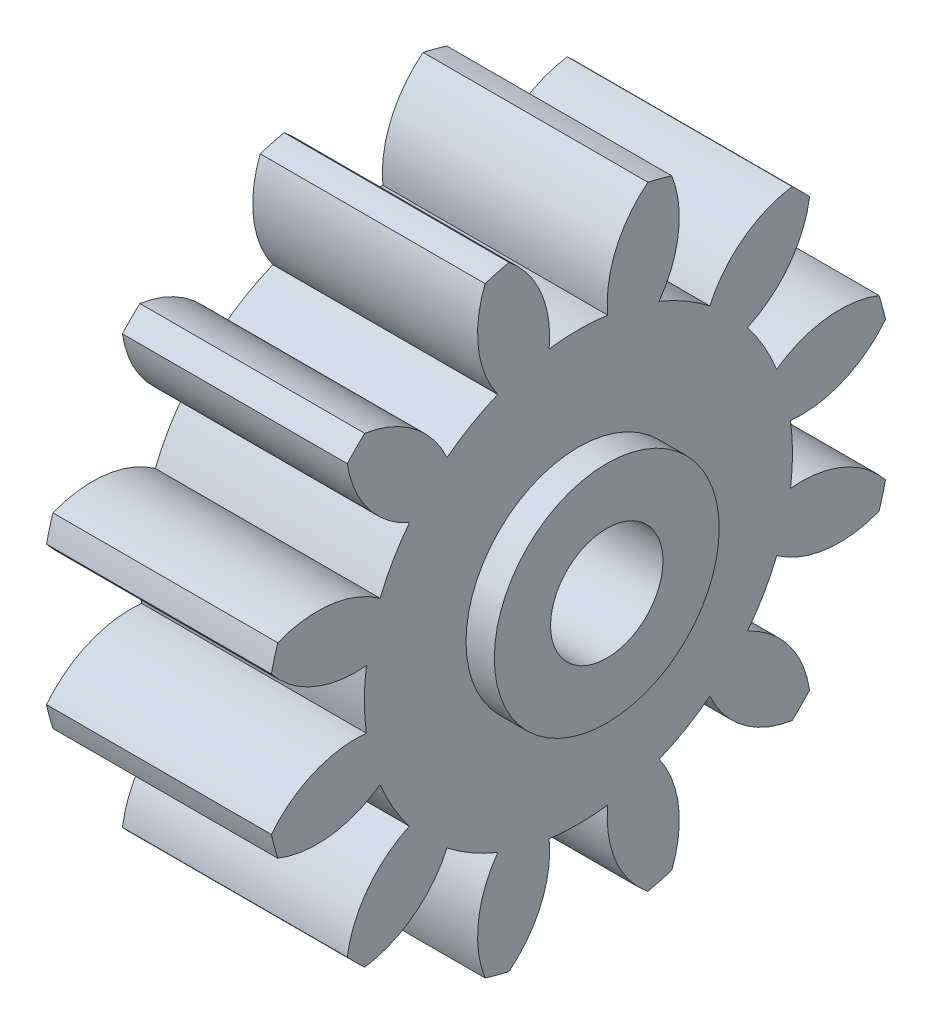
from build123d import *

# Parameters (mm, degrees)
SPUR_START             = -44.990479754
SPUR_GEAR_AI_OUTLINE_R = 1.5875
SPUR_GEAR_AI_DEPTH     = 6.35
SKETCH1_R              = 3.175
SKETCH1_R_2            = 1.5875
BOSS_EXTRUDE1_DEPTH    = 0.8001
BOSS_EXTRUDE2_START    = 0.8001
SKETCH2_R              = 3.175
SKETCH2_R_2            = 1.5875
BOSS_EXTRUDE2_DEPTH    = 0.8001


# Read off the part's stored shape, not the designer's step: spur gear_ai
with BuildPart() as part:
    # spur gear_ai outline → spur gear_ai (new body)
    with BuildSketch(Plane.YZ.offset(SPUR_START)):
        with BuildLine():
            ThreePointArc((12.717986851, 12.671800633), (12.969814044, 12.913920885), (13.211934296, 13.165748078))
            ThreePointArc((13.211934296, 13.165748078), (12.629555475, 14.550963045), (11.456113125, 15.489588981))
            ThreePointArc((11.456113125, 15.489588981), (11.91893153, 16.17750017), (12.283270893, 16.92226826))
            ThreePointArc((12.283270893, 16.92226826), (13.682865973, 16.375350343), (15.173686734, 16.563602973))
            ThreePointArc((15.173686734, 16.563602973), (15.270715355, 16.899198858), (15.354484047, 17.238347731))
            ThreePointArc((15.354484047, 17.238347731), (14.15752171, 18.146789672), (12.671977858, 18.372942402))
            ThreePointArc((12.671977858, 18.372942402), (12.728834759, 19.20010017), (12.671977858, 20.027257937))
            ThreePointArc((12.671977858, 20.027257937), (14.15752171, 20.253410667), (15.354484047, 21.161852608))
            ThreePointArc((15.354484047, 21.161852608), (15.270715355, 21.501001481), (15.173686734, 21.836597366))
            ThreePointArc((15.173686734, 21.836597366), (13.682865973, 22.024849997), (12.283270893, 21.477932079))
            ThreePointArc((12.283270893, 21.477932079), (11.91893153, 22.222700169), (11.456113125, 22.910611358))
            ThreePointArc((11.456113125, 22.910611358), (12.629555475, 23.849237294), (13.211934296, 25.234452261))
            ThreePointArc((13.211934296, 25.234452261), (12.969814044, 25.486279454), (12.717986851, 25.728399706))
            ThreePointArc((12.717986851, 25.728399706), (11.332771884, 25.146020886), (10.394145948, 23.972578536))
            ThreePointArc((10.394145948, 23.972578536), (9.706234759, 24.43539694), (8.961466669, 24.799736303))
            ThreePointArc((8.961466669, 24.799736303), (9.508384586, 26.199331383), (9.320131956, 27.690152144))
            ThreePointArc((9.320131956, 27.690152144), (8.98453607, 27.787180765), (8.645387197, 27.870949457))
            ThreePointArc((8.645387197, 27.870949457), (7.736945256, 26.673987121), (7.510792527, 25.188443268))
            ThreePointArc((7.510792527, 25.188443268), (6.68363476, 25.24530017), (5.856476992, 25.188443268))
            ThreePointArc((5.856476992, 25.188443268), (5.630324262, 26.673987121), (4.721882321, 27.870949457))
            ThreePointArc((4.721882321, 27.870949457), (4.382733448, 27.787180765), (4.047137563, 27.690152144))
            ThreePointArc((4.047137563, 27.690152144), (3.858884932, 26.199331383), (4.405802849, 24.799736303))
            ThreePointArc((4.405802849, 24.799736303), (3.661034759, 24.43539694), (2.97312357, 23.972578536))
            ThreePointArc((2.97312357, 23.972578536), (2.034497635, 25.146020886), (0.649282668, 25.728399706))
            ThreePointArc((0.649282668, 25.728399706), (0.397455474, 25.486279454), (0.155335223, 25.234452261))
            ThreePointArc((0.155335223, 25.234452261), (0.737714043, 23.849237294), (1.911156393, 22.910611358))
            ThreePointArc((1.911156393, 22.910611358), (1.448337988, 22.222700169), (1.083998625, 21.477932079))
            ThreePointArc((1.083998625, 21.477932079), (-0.315596455, 22.024849997), (-1.806417216, 21.836597366))
            ThreePointArc((-1.806417216, 21.836597366), (-1.903445837, 21.501001481), (-1.987214529, 21.161852608))
            ThreePointArc((-1.987214529, 21.161852608), (-0.790252192, 20.253410667), (0.695291661, 20.027257937))
            ThreePointArc((0.695291661, 20.027257937), (0.638434759, 19.20010017), (0.695291661, 18.372942402))
            ThreePointArc((0.695291661, 18.372942402), (-0.790252192, 18.146789672), (-1.987214529, 17.238347731))
            ThreePointArc((-1.987214529, 17.238347731), (-1.903445837, 16.899198858), (-1.806417216, 16.563602973))
            ThreePointArc((-1.806417216, 16.563602973), (-0.315596455, 16.375350343), (1.083998625, 16.92226826))
            ThreePointArc((1.083998625, 16.92226826), (1.448337988, 16.17750017), (1.911156393, 15.489588981))
            ThreePointArc((1.911156393, 15.489588981), (0.737714043, 14.550963045), (0.155335223, 13.165748078))
            ThreePointArc((0.155335223, 13.165748078), (0.397455474, 12.913920884), (0.649282668, 12.671800633))
            ThreePointArc((0.649282668, 12.671800633), (2.034497635, 13.254179453), (2.97312357, 14.427621803))
            ThreePointArc((2.97312357, 14.427621803), (3.661034759, 13.964803399), (4.405802849, 13.600464036))
            ThreePointArc((4.405802849, 13.600464036), (3.858884932, 12.200868956), (4.047137563, 10.710048195))
            ThreePointArc((4.047137563, 10.710048195), (4.382733448, 10.613019574), (4.721882321, 10.529250882))
            ThreePointArc((4.721882321, 10.529250882), (5.630324262, 11.726213218), (5.856476992, 13.211757071))
            ThreePointArc((5.856476992, 13.211757071), (6.68363476, 13.15490017), (7.510792527, 13.211757071))
            ThreePointArc((7.510792527, 13.211757071), (7.736945256, 11.726213218), (8.645387197, 10.529250882))
            ThreePointArc((8.645387197, 10.529250882), (8.98453607, 10.613019574), (9.320131956, 10.710048195))
            ThreePointArc((9.320131956, 10.710048195), (9.508384586, 12.200868956), (8.961466669, 13.600464036))
            ThreePointArc((8.961466669, 13.600464036), (9.706234759, 13.964803399), (10.394145948, 14.427621803))
            ThreePointArc((10.394145948, 14.427621803), (11.332771884, 13.254179453), (12.717986851, 12.671800633))
        make_face()
        with Locations((6.683634759, 19.20010017)):
            Circle(SPUR_GEAR_AI_OUTLINE_R, mode=Mode.SUBTRACT)
    extrude(amount=SPUR_GEAR_AI_DEPTH)

    # Sketch1 → Boss-Extrude1 (add)
    with BuildSketch(Plane(origin=(-38.640479754, 0, 0), x_dir=(0, 0, -1), z_dir=(1, 0, 0))):
        with Locations(Location((-19.20010017, 6.683634759, 0), (0, 0, 180))):
            Circle(SKETCH1_R)
        with Locations((-19.20010017, 6.683634759)):
            Circle(SKETCH1_R_2, mode=Mode.SUBTRACT)
    extrude(amount=BOSS_EXTRUDE1_DEPTH)

    # Sketch2 → Boss-Extrude2 (add)
    with BuildSketch(Plane.ZY.offset(44.990479754).offset(BOSS_EXTRUDE2_START)):
        with Locations((19.20010017, 6.683634759)):
            Circle(SKETCH2_R)
        with Locations((19.20010017, 6.683634759)):
            Circle(SKETCH2_R_2, mode=Mode.SUBTRACT)
    extrude(amount=-BOSS_EXTRUDE2_DEPTH)


solid = part.part
